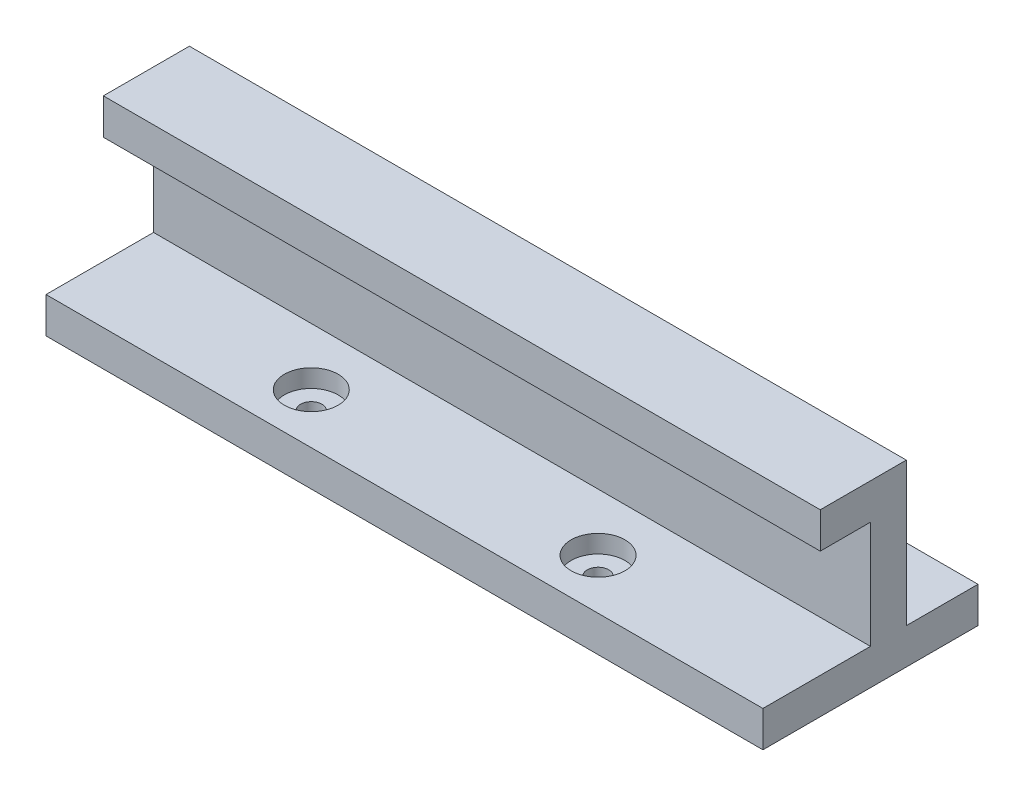
from build123d import *

# Parameters (mm, degrees)
SKETCH1_W                    = 100
SKETCH1_H                    = 20
SKETCH1_R                    = 1.5
EXTRUDE_BASE_DEPTH           = 5
SKETCH2_W                    = 100
SKETCH2_H                    = 5
EXTRUDE_VERTICAL_CLAMP_DEPTH = 20
SKETCH3_W                    = 100
SKETCH3_H                    = 5
EXTRUDE_CLAMP_ROOF_DEPTH     = 7
SKETCH5_W                    = 100
SKETCH5_H                    = 10
SKETCH5_R                    = 1.5
BOSS_EXTRUDE4_DEPTH          = 5
SKETCH4_R                    = 3.75
CUT_EXTRUDE1_DEPTH           = 2.5


with BuildPart() as part:
    # Sketch1 → Extrude-Base (new body)
    with BuildSketch(Plane(origin=(0, 0, 0), x_dir=(1, 0, 0), z_dir=(0, 1, 0))):
        with Locations((50, 10)):
            Rectangle(SKETCH1_W, SKETCH1_H)
        with Locations((30, 7)):
            Circle(SKETCH1_R, mode=Mode.SUBTRACT)
        with Locations((70, 7)):
            Circle(SKETCH1_R, mode=Mode.SUBTRACT)
    extrude(amount=EXTRUDE_BASE_DEPTH)

    # Sketch2 → Extrude-Vertical clamp (add)
    with BuildSketch(Plane(origin=(0, 5, 0), x_dir=(1, 0, 0), z_dir=(0, 1, 0))):
        with Locations((50, 17.5)):
            Rectangle(SKETCH2_W, SKETCH2_H)
    extrude(amount=EXTRUDE_VERTICAL_CLAMP_DEPTH)

    # Sketch3 → Extrude-Clamp Roof (add)
    with BuildSketch(Plane.XY.offset(-15)):
        with Locations((50, 22.5)):
            Rectangle(SKETCH3_W, SKETCH3_H)
    extrude(amount=EXTRUDE_CLAMP_ROOF_DEPTH)

    # Sketch5 → Boss-Extrude4 (add)
    with BuildSketch(Plane(origin=(0, 0, 0), x_dir=(1, 0, 0), z_dir=(0, 1, 0))):
        with Locations((50, 25)):
            Rectangle(SKETCH5_W, SKETCH5_H)
        with Locations((70, 25)):
            Circle(SKETCH5_R, mode=Mode.SUBTRACT)
        with Locations((30, 25)):
            Circle(SKETCH5_R, mode=Mode.SUBTRACT)
    extrude(amount=BOSS_EXTRUDE4_DEPTH)

    # Sketch4 → Cut-Extrude1 (cut)
    with BuildSketch(Plane(origin=(0, 5, 0), x_dir=(1, 0, 0), z_dir=(0, 1, 0))):
        with Locations((30, 7)):
            Circle(SKETCH4_R)
        with Locations((70, 7)):
            Circle(SKETCH4_R)
        with Locations((30, 25)):
            Circle(SKETCH4_R)
        with Locations((70, 25)):
            Circle(SKETCH4_R)
    extrude(amount=-CUT_EXTRUDE1_DEPTH, mode=Mode.SUBTRACT)


solid = part.part
